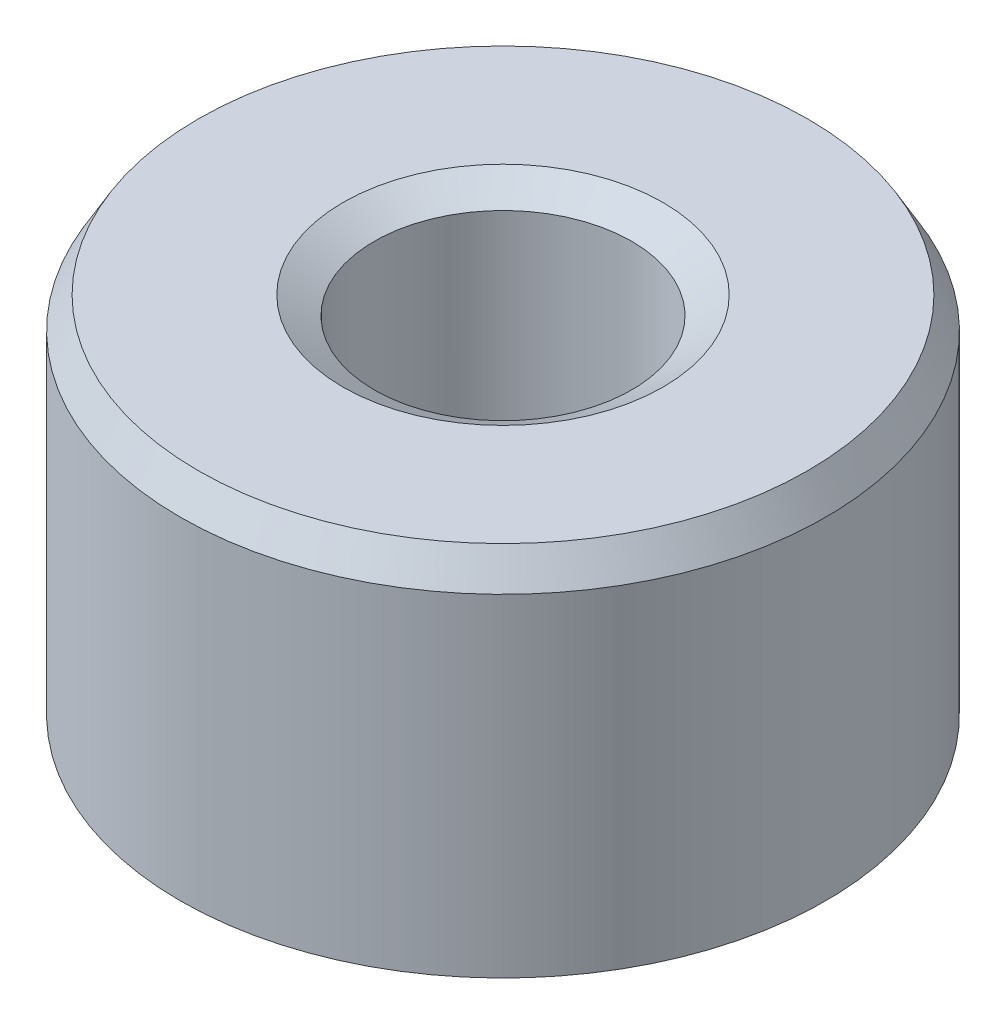
from build123d import *
from OCP.BRepFilletAPI import BRepFilletAPI_MakeChamfer

# Parameters (mm, degrees)
SKETCH1_R           = 35
BOSS_EXTRUDE1_DEPTH = 41.373761375
SKETCH2_R           = 13.964137347
CUT_EXTRUDE1_DEPTH  = 65.511922389
CHAMFER1_SIZE       = 3.385181466
CHAMFER1_SIZE2      = 1.954435431


with BuildPart() as part:
    # Sketch1 → Boss-Extrude1 (new body)
    with BuildSketch(Plane(origin=(0, 0, 0), x_dir=(1, 0, 0), z_dir=(0, 1, 0))):
        Circle(SKETCH1_R)
    extrude(amount=BOSS_EXTRUDE1_DEPTH)

    # Sketch2 → Cut-Extrude1 (cut, through all)
    with BuildSketch(Plane(origin=(0, 0, 0), x_dir=(1, 0, 0), z_dir=(0, 1, 0))):
        Circle(SKETCH2_R)
    extrude(amount=CUT_EXTRUDE1_DEPTH, mode=Mode.SUBTRACT)

    # Chamfer1: one chamfer whose edges measure the first distance from different faces: ONE call of the kernel's chamfer builder (chamfer() names one face for all edges)
    chamfer1_edges_1 = [part.edges().sort_by_distance(p)[0] for p in [
        (-13.964137347, 41.373761375, 0),
    ]]
    chamfer1_side_1 = [part.faces().sort_by_distance(p)[0] for p in [
        (-34.010050506, 41.373761375, 0),
    ]]
    chamfer1_edges_2 = [part.edges().sort_by_distance(p)[0] for p in [
        (-13.964137347, 0, 0),
    ]]
    chamfer1_side_2 = [part.faces().sort_by_distance(p)[0] for p in [
        (-13.964137347, 20.686880688, 0),
    ]]
    chamfer1_edges_3 = [part.edges().sort_by_distance(p)[0] for p in [
        (-35, 0, 0),
    ]]
    chamfer1_side_3 = [part.faces().sort_by_distance(p)[0] for p in [
        (-34.010050506, 0, 0),
    ]]
    chamfer1_edges_4 = [part.edges().sort_by_distance(p)[0] for p in [
        (-35, 41.373761375, 0),
    ]]
    chamfer1_side_4 = [part.faces().sort_by_distance(p)[0] for p in [
        (-35, 20.686880688, 0),
    ]]
    chamfer1 = BRepFilletAPI_MakeChamfer(part.part.solid().wrapped)
    for e in chamfer1_edges_1:
        chamfer1.Add(CHAMFER1_SIZE, CHAMFER1_SIZE2, e.wrapped, chamfer1_side_1[0].wrapped)  # the first distance lies on this face
    for e in chamfer1_edges_2:
        chamfer1.Add(CHAMFER1_SIZE, CHAMFER1_SIZE2, e.wrapped, chamfer1_side_2[0].wrapped)  # the first distance lies on this face
    for e in chamfer1_edges_3:
        chamfer1.Add(CHAMFER1_SIZE, CHAMFER1_SIZE2, e.wrapped, chamfer1_side_3[0].wrapped)  # the first distance lies on this face
    for e in chamfer1_edges_4:
        chamfer1.Add(CHAMFER1_SIZE, CHAMFER1_SIZE2, e.wrapped, chamfer1_side_4[0].wrapped)  # the first distance lies on this face
    add(Compound.cast(chamfer1.Shape()), mode=Mode.REPLACE)


solid = part.part
